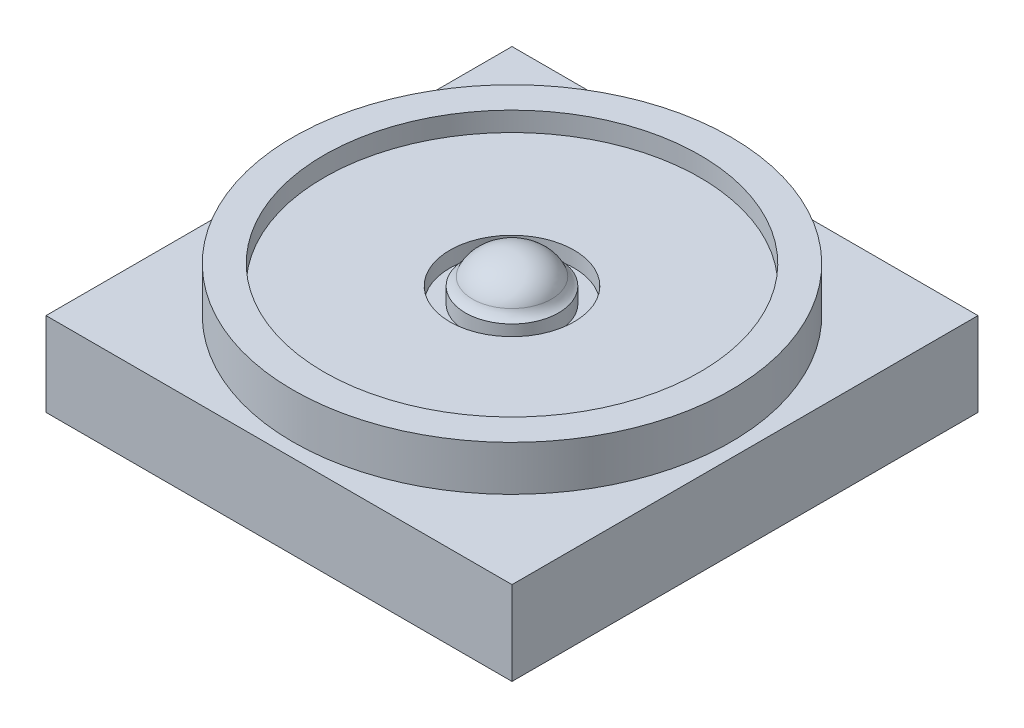
from build123d import *

# Parameters (mm, degrees)
SKETCH3_W             = 30
SKETCH3_H             = 30
SKETCH3_R             = 14.1
RECTANGLE_DEPTH       = 5.4
SKETCH3_3_R           = 14.1
SKETCH3_3_R_2         = 12.1
RIM_DEPTH             = 8.3
SKETCH3_5_R           = 12.1
SKETCH3_5_R_2         = 4
FLAT_FACE_DEPTH       = 7.05
SKETCH3_6_R           = 4
SKETCH3_6_R_2         = 3
GAP_DEPTH             = 6.05
SKETCH3_7_R           = 3
DOME_FACE_OUTER_DEPTH = 7.05
SKETCH5_R             = 2.64
DOME_FACE_INNER_DEPTH = 0.001
DOME_FACE_RADIUS      = 2.64
DOME_HEIGHT           = 1.95
DOME_FILLET_R         = 1.05
SKETCH6_W             = 2.512820513
SKETCH6_H             = 0.224358975
LABEL_DEPTH           = 0.2


with BuildPart() as part:
    # Sketch3 → Rectangle (new body)
    with BuildSketch(Plane(origin=(0, 0, 0), x_dir=(1, 0, 0), z_dir=(0, 1, 0))):
        Rectangle(SKETCH3_W, SKETCH3_H)
        with Locations(Location((0, 0, 0), (0, 0, 90))):
            Circle(SKETCH3_R, mode=Mode.SUBTRACT)
    extrude(amount=RECTANGLE_DEPTH)

    # Sketch3<3> → Rim (add)
    with BuildSketch(Plane(origin=(0, 0, 0), x_dir=(1, 0, 0), z_dir=(0, 1, 0))):
        with Locations(Location((0, 0, 0), (0, 0, 270))):
            Circle(SKETCH3_3_R)
        with Locations(Location((0, 0, 0), (0, 0, 270))):
            Circle(SKETCH3_3_R_2, mode=Mode.SUBTRACT)
    extrude(amount=RIM_DEPTH)

    # Sketch3<5> → Flat_face (add)
    with BuildSketch(Plane(origin=(0, 0, 0), x_dir=(1, 0, 0), z_dir=(0, 1, 0))):
        with Locations(Location((0, 0, 0), (0, 0, 270))):
            Circle(SKETCH3_5_R)
        with Locations(Location((0, 0, 0), (0, 0, 270))):
            Circle(SKETCH3_5_R_2, mode=Mode.SUBTRACT)
    extrude(amount=FLAT_FACE_DEPTH)

    # Sketch3<6> → Gap (add)
    with BuildSketch(Plane(origin=(0, 0, 0), x_dir=(1, 0, 0), z_dir=(0, 1, 0))):
        with Locations(Location((0, 0, 0), (0, 0, 270))):
            Circle(SKETCH3_6_R)
        with Locations(Location((0, 0, 0), (0, 0, 270))):
            Circle(SKETCH3_6_R_2, mode=Mode.SUBTRACT)
    extrude(amount=GAP_DEPTH)

    # Sketch3<7> → Dome_face_outer (add)
    with BuildSketch(Plane(origin=(0, 0, 0), x_dir=(1, 0, 0), z_dir=(0, 1, 0))):
        with Locations(Location((0, 0, 0), (0, 0, 270))):
            Circle(SKETCH3_7_R)
    extrude(amount=DOME_FACE_OUTER_DEPTH)

    # Sketch5 → Dome_face_inner (add)
    with BuildSketch(Plane(origin=(0, 7.05, 0), x_dir=(1, 0, 0), z_dir=(0, 1, 0))):
        with Locations(Location((0, 0, 0), (0, 0, 270))):
            Circle(SKETCH5_R)
    extrude(amount=DOME_FACE_INNER_DEPTH)

    # Dome: an elliptical dome of height H over a round flat face of radius A is half a spheroid: the quarter ellipse of half axes A and H revolved about the face's axis
    with BuildSketch(Plane((0, 7.051, 0), x_dir=(0, 0, -1), z_dir=(1, 0, 0)), mode=Mode.PRIVATE) as dome_quarter:
        Ellipse(DOME_FACE_RADIUS, DOME_HEIGHT)
        Rectangle(DOME_FACE_RADIUS, DOME_HEIGHT, align=(Align.MIN, Align.MIN), mode=Mode.INTERSECT)
    revolve(dome_quarter.sketch, axis=Axis((0, 7.051, 0), (0, 1, 0)))

    # Dome_Fillet
    # the kernel refuses this fillet: 1.05 mm, written as the material it adds along each edge
    with BuildSketch(Plane(origin=(0, 7.05, 0), x_dir=(0, 0, 1), z_dir=(-1, 0, 0))) as dome_fillet_piece_1:
        with BuildLine():
            CenterArc((3.518709078, 0.91292984), DOME_FILLET_R, 201.086857752, 39.308741684)
            Line((2.539021189, 0.535157898), (2.441052401, 0.497380703))
            ThreePointArc((2.441052401, 0.497380703), (2.535, 0.001), (2.535, 0))
            Line((2.535, 0), (2.64, -0.105))
            ThreePointArc((2.64, -0.105), (2.82, -0.105), (2.948129092, -0.091292984))
            Line((2.948129092, -0.091292984), (3, 0))
        make_face()
    revolve(axis=Axis((0, 7.05, 0), (0, 1, 0)))

    # Sketch6 → Label (cut)
    # profile 1 of 8: a face of its own
    with BuildSketch(Plane(origin=(0, 0, 0), x_dir=(1, 0, 0), z_dir=(0, 1, 0))):
        Polygon((6.943950172, -6.089985338), (5.328565557, -9.589985338), (5.670011871, -9.589985338), (6.187439755, -8.468190467), (7.774078377, -8.468190467), (8.306229819, -9.589985338), (8.649078377, -9.589985338), (6.988821967, -6.089985338), align=None)
        Polygon((6.969891678, -6.772176845), (7.603705781, -8.109216108), (6.352904499, -8.109216108), align=None, mode=Mode.SUBTRACT)
    # profile 2 of 8: a face of its own
    with BuildSketch(Plane(origin=(0, 0, 0), x_dir=(1, 0, 0), z_dir=(0, 1, 0))):
        Polygon((4.700360428, -6.089985338), (4.386257864, -6.089985338), (4.386257864, -9.231010979), (3.040104018, -9.231010979), (3.040104018, -9.589985338), (4.700360428, -9.589985338), align=None)
    # profile 3 of 8: a face of its own
    with BuildSketch(Plane(origin=(0, 0, 0), x_dir=(1, 0, 0), z_dir=(0, 1, 0))):
        Polygon((2.456770685, -6.089985338), (2.142668121, -6.089985338), (2.142668121, -9.231010979), (0.796514274, -9.231010979), (0.796514274, -9.589985338), (2.456770685, -9.589985338), align=None)
    # profile 4 of 8: a face of its own
    with BuildSketch(Plane(origin=(0, 0, 0), x_dir=(1, 0, 0), z_dir=(0, 1, 0))):
        with Locations((-0.549639571, -10.061139184)):
            Rectangle(SKETCH6_W, SKETCH6_H)
    # profile 5 of 8: a face of its own
    with BuildSketch(Plane(origin=(0, 0, 0), x_dir=(1, 0, 0), z_dir=(0, 1, 0))):
        with BuildLine():
            add(Edge.make_bspline(
                [(-3.847716495, -6.000241749), (-3.912524601, -6.001883228), (-4.039813068, -6.005107229), (-4.226887965, -6.029786332), (-4.405483061, -6.072481722), (-4.577053199, -6.129344705), (-4.739546176, -6.20519909), (-4.894185069, -6.296884239), (-5.040601942, -6.405360697), (-5.176823324, -6.529789924), (-5.301480274, -6.665173378), (-5.41130616, -6.809651288), (-5.503348454, -6.962350091), (-5.578934241, -7.122810921), (-5.638232851, -7.290670889), (-5.679151895, -7.466824892), (-5.705290045, -7.650131582), (-5.708345822, -7.775158447), (-5.709895982, -7.838583095)],
                knots=[0, 0, 0, 0, 1.065120563, 2.091984664, 3.0946048, 4.079830382, 5.057816894, 6.036188127, 7.030412546, 8.04752943, 9.064399622, 10.05169764, 11.02544977, 11.989514704, 12.962713494, 13.945757189, 14.957906945, 16, 16, 16, 16], degree=3))
            add(Edge.make_bspline(
                [(-5.709895982, -7.838583095), (-5.708346049, -7.901540541), (-5.705290953, -8.025636962), (-5.679122175, -8.207780406), (-5.638081175, -8.382871102), (-5.579484909, -8.550616755), (-5.504259431, -8.711194319), (-5.41160426, -8.864181273), (-5.302463049, -9.009627771), (-5.178256198, -9.145940436), (-5.042855156, -9.270937907), (-4.897624889, -9.379856783), (-4.745831569, -9.473580907), (-4.585521861, -9.548364581), (-4.418821824, -9.608136502), (-4.244239501, -9.648889132), (-4.062592947, -9.675176175), (-3.938721943, -9.678194691), (-3.875761367, -9.679728928)],
                knots=[0, 0, 0, 0, 1.043624062, 2.057103931, 3.04512605, 4.022047818, 4.998200453, 5.980619268, 6.982898556, 8.009068085, 9.034988726, 10.034168286, 11.015286542, 11.987931943, 12.962482838, 13.94673481, 14.956375938, 16, 16, 16, 16], degree=3))
            add(Edge.make_bspline(
                [(-3.875761367, -9.679728928), (-3.812337048, -9.678179541), (-3.687310832, -9.675125287), (-3.503773796, -9.648943883), (-3.327496052, -9.608002579), (-3.158981701, -9.549493143), (-2.998136772, -9.473875912), (-2.844646689, -9.381671533), (-2.699127542, -9.272264392), (-2.562785795, -9.148097817), (-2.438036597, -9.012926265), (-2.329277221, -8.86809201), (-2.237052108, -8.716436553), (-2.161688775, -8.557539029), (-2.102024316, -8.392167586), (-2.061319498, -8.219219109), (-2.034983546, -8.039679603), (-2.031948699, -7.917436705), (-2.030408802, -7.855410018)],
                knots=[0, 0, 0, 0, 1.053102029, 2.075944431, 3.073151272, 4.055350789, 5.033113405, 6.020478099, 7.024410459, 8.052272461, 9.079885166, 10.07527673, 11.055994387, 12.023226415, 12.992069828, 13.970394897, 14.97016774, 16, 16, 16, 16], degree=3))
            add(Edge.make_bspline(
                [(-2.030408802, -7.855410018), (-2.030943438, -7.813777349), (-2.032005964, -7.731037225), (-2.044797657, -7.608170625), (-2.063359358, -7.487279967), (-2.089961271, -7.368709019), (-2.124752938, -7.252748035), (-2.165804965, -7.138597272), (-2.21594481, -7.027413548), (-2.272625458, -6.918670156), (-2.335887266, -6.81406225), (-2.405763016, -6.715182667), (-2.479798384, -6.621201671), (-2.560961778, -6.534554667), (-2.646578223, -6.45272101), (-2.738036601, -6.376958293), (-2.834778846, -6.306583342), (-2.937221225, -6.243163001), (-3.0428395, -6.185803867), (-3.151716278, -6.136582016), (-3.26237285, -6.094335954), (-3.375327497, -6.060095129), (-3.49028027, -6.033063093), (-3.607482054, -6.014655739), (-3.72683948, -6.001831421), (-3.807250799, -6.000773919), (-3.847716495, -6.000241749)],
                knots=[0, 0, 0, 0, 1.037015668, 2.060948919, 3.074880161, 4.083647147, 5.086022904, 6.090072063, 7.104153813, 8.122640571, 9.144368836, 10.147691507, 11.138137339, 12.123020368, 13.103399296, 14.087645067, 15.080126199, 16.082011238, 17.087798457, 18.072939717, 19.057185487, 20.037253025, 21.01195951, 21.997135196, 22.992090687, 24, 24, 24, 24], degree=3))
        make_face()
        with BuildLine():
            add(Edge.make_bspline(
                [(-3.863141174, -6.359216108), (-3.829926541, -6.359620998), (-3.763814808, -6.360426908), (-3.665530272, -6.371042623), (-3.568538338, -6.386172512), (-3.472818976, -6.407754033), (-3.378772686, -6.437158086), (-3.285522845, -6.470998994), (-3.193919791, -6.512220084), (-3.104265933, -6.558792789), (-3.017350858, -6.61034171), (-2.935338157, -6.667313477), (-2.858015513, -6.728372031), (-2.785572246, -6.793659868), (-2.718221074, -6.86350947), (-2.654636372, -6.936861906), (-2.597366791, -7.015813797), (-2.544881214, -7.098224204), (-2.497913374, -7.183985785), (-2.456148019, -7.272195648), (-2.42198401, -7.363573334), (-2.394121634, -7.457127492), (-2.371021823, -7.552709952), (-2.356387899, -7.6510458), (-2.345655539, -7.751640912), (-2.344895694, -7.819622767), (-2.344511367, -7.854007774)],
                knots=[0, 0, 0, 0, 1.008559885, 2.007477868, 2.99961109, 3.989939068, 4.984837346, 5.991145699, 7.001802488, 8.033829008, 9.059044045, 10.069351652, 11.065060232, 12.050310815, 13.029377138, 14.011219647, 14.996725999, 15.989392538, 16.977580475, 17.965360261, 18.951710183, 19.937753436, 20.929683414, 21.935841486, 22.955955122, 24, 24, 24, 24], degree=3))
            add(Edge.make_bspline(
                [(-2.344511367, -7.854007774), (-2.345786229, -7.904569995), (-2.348294276, -8.004041525), (-2.370251846, -8.149809669), (-2.404073821, -8.289897956), (-2.453931187, -8.423539865), (-2.516281802, -8.551884148), (-2.593308692, -8.673792252), (-2.684567778, -8.789297127), (-2.788231304, -8.897592396), (-2.901554011, -8.9964382), (-3.021886741, -9.083201609), (-3.147940349, -9.156611858), (-3.280043551, -9.216416931), (-3.41749109, -9.263806669), (-3.561168641, -9.2962853), (-3.710119101, -9.317660755), (-3.811649756, -9.319713511), (-3.863141174, -9.320754569)],
                knots=[0, 0, 0, 0, 1.032063989, 2.030389145, 3.003944642, 3.970395727, 4.937377036, 5.913328081, 6.909231446, 7.93887556, 8.970685674, 9.976071282, 10.964166581, 11.944589148, 12.933237628, 13.927779006, 14.949070134, 16, 16, 16, 16], degree=3))
            add(Edge.make_bspline(
                [(-3.863141174, -9.320754569), (-3.897750676, -9.320279065), (-3.966391712, -9.319335997), (-4.068487235, -9.30983732), (-4.168743446, -9.294605451), (-4.267019726, -9.272674795), (-4.363204538, -9.245227589), (-4.457699341, -9.212619861), (-4.549497631, -9.171938657), (-4.639757469, -9.126990705), (-4.726153711, -9.075750548), (-4.808629243, -9.020712398), (-4.885105223, -8.959743777), (-4.957494294, -8.895425965), (-5.025121983, -8.826462117), (-5.087530967, -8.752941895), (-5.144511099, -8.674401238), (-5.196976746, -8.592115832), (-5.243780009, -8.506119579), (-5.284559108, -8.417589902), (-5.319155224, -8.326744792), (-5.347083729, -8.233453221), (-5.36896919, -8.137892372), (-5.38404911, -8.039934294), (-5.394597549, -7.939774951), (-5.395392626, -7.872031095), (-5.395793418, -7.837881973)],
                knots=[0, 0, 0, 0, 1.047197238, 2.076906641, 3.100256066, 4.114471768, 5.12198147, 6.126382909, 7.136867548, 8.15857795, 9.17633901, 10.174870724, 11.156907918, 12.133735059, 13.104061851, 14.077631395, 15.04955518, 16.038496417, 17.029181396, 18.010275684, 18.986308667, 19.968651475, 20.955262928, 21.950658345, 22.966943676, 24, 24, 24, 24], degree=3))
            add(Edge.make_bspline(
                [(-5.395793418, -7.837881973), (-5.395392305, -7.803966469), (-5.394596623, -7.736688819), (-5.384054149, -7.637228), (-5.368953258, -7.539974789), (-5.34719055, -7.445310986), (-5.319140397, -7.353212461), (-5.284553066, -7.263765713), (-5.243767767, -7.176637518), (-5.196959542, -7.092043221), (-5.144343719, -7.010868483), (-5.086849476, -6.93326607), (-5.023484127, -6.860693329), (-4.956058103, -6.791358635), (-4.882887217, -6.726740745), (-4.804302923, -6.666818225), (-4.721259245, -6.61014495), (-4.63333201, -6.559019389), (-4.542588056, -6.511805156), (-4.449474098, -6.471354153), (-4.355044999, -6.436982033), (-4.259540886, -6.407665068), (-4.162157908, -6.386257038), (-4.063554079, -6.371028988), (-3.963865821, -6.360430602), (-3.896822601, -6.359622224), (-3.863141174, -6.359216108)],
                knots=[0, 0, 0, 0, 1.02996197, 2.043119294, 3.035359645, 4.018872909, 4.991431989, 5.957985074, 6.929999688, 7.912076566, 8.892894881, 9.867085534, 10.843653904, 11.817741046, 12.803660682, 13.806313499, 14.818574707, 15.856120519, 16.894564902, 17.924820532, 18.937903209, 19.946497019, 20.957711757, 21.963978472, 22.977135795, 24, 24, 24, 24], degree=3))
        make_face(mode=Mode.SUBTRACT)
    # profile 6 of 8: a face of its own
    with BuildSketch(Plane(origin=(0, 0, 0), x_dir=(1, 0, 0), z_dir=(0, 1, 0))):
        with BuildLine():
            Line((-6.068870341, -8.91480505), (-6.364743738, -8.737421236))
            add(Edge.make_bspline(
                [(-6.364743738, -8.737421236), (-6.392261976, -8.783485621), (-6.444985856, -8.871743205), (-6.532937215, -8.991001245), (-6.624070127, -9.092363402), (-6.71905946, -9.175240009), (-6.817325408, -9.240488896), (-6.919509462, -9.286691128), (-7.025267273, -9.315507103), (-7.097241094, -9.31900719), (-7.133173226, -9.320754569)],
                knots=[0, 0, 0, 0, 1.272034388, 2.437168799, 3.508375237, 4.49857839, 5.41946034, 6.295179144, 7.148887113, 8, 8, 8, 8], degree=3))
            add(Edge.make_bspline(
                [(-7.133173226, -9.320754569), (-7.163860086, -9.319899897), (-7.224696859, -9.318205506), (-7.314259102, -9.301924704), (-7.401240904, -9.276912575), (-7.483849542, -9.241091644), (-7.560945157, -9.197753158), (-7.628551852, -9.145406981), (-7.686997965, -9.086800775), (-7.73480708, -9.02141812), (-7.771487115, -8.951100972), (-7.799679183, -8.87892502), (-7.815324257, -8.803756452), (-7.81768101, -8.753145989), (-7.818870341, -8.727605531)],
                knots=[0, 0, 0, 0, 1.095163259, 2.171163733, 3.241058638, 4.321873601, 5.38011039, 6.391990106, 7.366004449, 8.327778327, 9.272591725, 10.192022065, 11.087607919, 12, 12, 12, 12], degree=3))
            add(Edge.make_bspline(
                [(-7.818870341, -8.727605531), (-7.81739603, -8.698464681), (-7.814398972, -8.639225592), (-7.789067492, -8.551825939), (-7.749218245, -8.465333369), (-7.712455601, -8.411832103), (-7.69336954, -8.384055851)],
                knots=[0, 0, 0, 0, 0.938893495, 1.908633276, 2.914225137, 4, 4, 4, 4], degree=3))
            add(Edge.make_bspline(
                [(-7.69336954, -8.384055851), (-7.677698925, -8.364009028), (-7.644800431, -8.321923229), (-7.588242919, -8.259277994), (-7.521876804, -8.194659575), (-7.447973249, -8.125600518), (-7.363840161, -8.055312721), (-7.272112646, -7.980444443), (-7.170448787, -7.903842866), (-7.099149291, -7.8524703), (-7.062359924, -7.825962902)],
                knots=[0, 0, 0, 0, 0.722233717, 1.516239348, 2.393582979, 3.351407094, 4.387010283, 5.505090956, 6.712668013, 8, 8, 8, 8], degree=3))
            add(Edge.make_bspline(
                [(-7.062359924, -7.825962902), (-7.025535928, -7.799734315), (-6.955131251, -7.749587253), (-6.856672669, -7.675162969), (-6.768628206, -7.607119099), (-6.69138919, -7.544815087), (-6.624989593, -7.488242482), (-6.568906182, -7.437944543), (-6.524567625, -7.392560982), (-6.499912044, -7.36311964), (-6.488842296, -7.349901204)],
                knots=[0, 0, 0, 0, 1.452282411, 2.77665338, 3.964542531, 5.026858415, 5.96415736, 6.766646006, 7.446254459, 8, 8, 8, 8], degree=3))
            add(Edge.make_bspline(
                [(-6.488842296, -7.349901204), (-6.473369751, -7.329300167), (-6.442940914, -7.288785463), (-6.402774909, -7.225460605), (-6.368635746, -7.16063734), (-6.341873414, -7.094141475), (-6.319337195, -7.026906547), (-6.304179264, -6.958055301), (-6.294687867, -6.887896682), (-6.293715881, -6.840683182), (-6.293229315, -6.81704864)],
                knots=[0, 0, 0, 0, 1.068054152, 2.10047183, 3.106115577, 4.101338837, 5.06977816, 6.043150881, 7.020423561, 8, 8, 8, 8], degree=3))
            add(Edge.make_bspline(
                [(-6.293229315, -6.81704864), (-6.294534524, -6.780018865), (-6.297117044, -6.706750801), (-6.318957562, -6.599719971), (-6.353430455, -6.497533554), (-6.401725343, -6.40120322), (-6.463982696, -6.313237239), (-6.53602867, -6.232623752), (-6.621840157, -6.16485517), (-6.71599278, -6.105643111), (-6.819049152, -6.059297186), (-6.927040055, -6.024336206), (-7.040137127, -6.004526948), (-7.116740262, -6.001684184), (-7.155609123, -6.000241749)],
                knots=[0, 0, 0, 0, 1.005424448, 1.989358655, 2.955360095, 3.929531133, 4.905563448, 5.876582895, 6.856512386, 7.866279853, 8.892233794, 9.918561126, 10.94386622, 12, 12, 12, 12], degree=3))
            add(Edge.make_bspline(
                [(-7.155609123, -6.000241749), (-7.196853223, -6.0016643), (-7.278874575, -6.004493301), (-7.399523791, -6.029090833), (-7.515684507, -6.069791504), (-7.609127772, -6.115980162), (-7.682260533, -6.162111578), (-7.738033266, -6.204131402), (-7.794550717, -6.252506511), (-7.852268772, -6.307365757), (-7.910209431, -6.369212508), (-7.969232883, -6.437623197), (-8.029477152, -6.512179753), (-8.068233012, -6.565404254), (-8.08810111, -6.592689665)],
                knots=[0, 0, 0, 0, 1.286793592, 2.559021753, 3.825965368, 5.121522368, 5.803751409, 6.523245864, 7.299691795, 8.125521123, 9.008227632, 9.944561021, 10.946284179, 12, 12, 12, 12], degree=3))
            Line((-8.08810111, -6.592689665), (-7.804146783, -6.807934056))
            add(Edge.make_bspline(
                [(-7.804146783, -6.807934056), (-7.787000851, -6.785845366), (-7.753981794, -6.743307713), (-7.703852307, -6.683736397), (-7.656603659, -6.629319918), (-7.610053259, -6.58205479), (-7.566659628, -6.539352656), (-7.524542585, -6.502792899), (-7.484308234, -6.472017304), (-7.433591324, -6.439173744), (-7.369873605, -6.40661724), (-7.289889069, -6.379068162), (-7.206302794, -6.3625131), (-7.149373162, -6.360324213), (-7.120553033, -6.359216108)],
                knots=[0, 0, 0, 0, 1.181633172, 2.275549214, 3.290209073, 4.226197932, 5.078386478, 5.862611352, 6.581680152, 7.217281963, 8.414376989, 9.595101626, 10.782541182, 12, 12, 12, 12], degree=3))
            add(Edge.make_bspline(
                [(-7.120553033, -6.359216108), (-7.084396511, -6.360427808), (-7.014672063, -6.362764457), (-6.915681827, -6.388284442), (-6.826587902, -6.428466302), (-6.750035337, -6.48478128), (-6.68629836, -6.551502273), (-6.640192901, -6.628281128), (-6.612442737, -6.713063531), (-6.609056457, -6.772205187), (-6.607331879, -6.802325082)],
                knots=[0, 0, 0, 0, 1.14458467, 2.207223713, 3.21896685, 4.227309161, 5.202851033, 6.127160689, 7.046193047, 8, 8, 8, 8], degree=3))
            add(Edge.make_bspline(
                [(-6.607331879, -6.802325082), (-6.607725006, -6.82107656), (-6.608511902, -6.85861018), (-6.6194867, -6.914061602), (-6.633586029, -6.969372941), (-6.655928661, -7.024295524), (-6.686773964, -7.079789883), (-6.72727914, -7.136811621), (-6.778292452, -7.195863329), (-6.817369464, -7.234270703), (-6.83800095, -7.25454864)],
                knots=[0, 0, 0, 0, 0.858281714, 1.717966888, 2.583508476, 3.4729293, 4.427298488, 5.488583878, 6.674047936, 8, 8, 8, 8], degree=3))
            add(Edge.make_bspline(
                [(-6.83800095, -7.25454864), (-6.845662322, -7.261385665), (-6.863863989, -7.277628874), (-6.897139915, -7.304221154), (-6.941082713, -7.337023927), (-6.994544915, -7.377611243), (-7.058512276, -7.424692705), (-7.132991832, -7.477666317), (-7.217153365, -7.538251776), (-7.276875281, -7.580609317), (-7.308453674, -7.603006172)],
                knots=[0, 0, 0, 0, 0.420754252, 0.999615792, 1.744751191, 2.668019286, 3.750313428, 4.999500688, 6.413464383, 8, 8, 8, 8], degree=3))
            add(Edge.make_bspline(
                [(-7.308453674, -7.603006172), (-7.346439588, -7.630647531), (-7.419994044, -7.684171193), (-7.524651624, -7.764586873), (-7.619545432, -7.843234642), (-7.705008636, -7.919612249), (-7.781885544, -7.993140342), (-7.849323265, -8.064703522), (-7.908008945, -8.133789095), (-7.971188163, -8.22236167), (-8.035745983, -8.331142755), (-8.09118749, -8.464420993), (-8.126145838, -8.598217314), (-8.130717353, -8.68814415), (-8.132972905, -8.732513383)],
                knots=[0, 0, 0, 0, 1.163667725, 2.253281268, 3.268753668, 4.215851969, 5.092017293, 5.902905408, 6.650798638, 7.335211899, 8.59617414, 9.77448103, 10.901945474, 12, 12, 12, 12], degree=3))
            add(Edge.make_bspline(
                [(-8.132972905, -8.732513383), (-8.132315767, -8.763891748), (-8.131014252, -8.826039132), (-8.116053338, -8.917294209), (-8.094133673, -9.005925078), (-8.061096439, -9.090836191), (-8.020773281, -9.173580954), (-7.969607033, -9.251988854), (-7.910299348, -9.327795253), (-7.842265583, -9.398978744), (-7.767819681, -9.46432494), (-7.689135986, -9.522454001), (-7.606085713, -9.570922325), (-7.519119397, -9.610473167), (-7.42821706, -9.641406684), (-7.333409276, -9.663819553), (-7.234539765, -9.677575264), (-7.167339283, -9.679003026), (-7.133173226, -9.679728928)],
                knots=[0, 0, 0, 0, 0.983748083, 1.948392443, 2.894712957, 3.844097841, 4.80183111, 5.778335162, 6.776009319, 7.81870978, 8.863265674, 9.881300176, 10.883814829, 11.87499822, 12.874611388, 13.892143829, 14.928324115, 16, 16, 16, 16], degree=3))
            add(Edge.make_bspline(
                [(-7.133173226, -9.679728928), (-7.106737883, -9.679217747), (-7.054200123, -9.678201821), (-6.976490641, -9.669220541), (-6.900351051, -9.656513437), (-6.826736769, -9.636339367), (-6.754699358, -9.61186239), (-6.684552123, -9.581724057), (-6.616261069, -9.545606856), (-6.549443487, -9.504311831), (-6.484269312, -9.456254087), (-6.421349844, -9.40028059), (-6.358620658, -9.337935085), (-6.297933262, -9.267524522), (-6.238060118, -9.190186439), (-6.180181708, -9.105197256), (-6.123099991, -9.013019902), (-6.087284523, -8.948154816), (-6.068870341, -8.91480505)],
                knots=[0, 0, 0, 0, 0.915332311, 1.819136955, 2.706846663, 3.586547465, 4.459518054, 5.340707479, 6.227863349, 7.133153174, 8.059268498, 9.028702269, 10.047606654, 11.120612155, 12.245963614, 13.433783089, 14.680604001, 16, 16, 16, 16], degree=3))
        make_face()
    # profile 7 of 8: a face of its own
    with BuildSketch(Plane(origin=(0, 0, 0), x_dir=(1, 0, 0), z_dir=(0, 1, 0))):
        with Locations((-9.613742136, -10.061139184)):
            Rectangle(SKETCH6_W, SKETCH6_H)
    # profile 8 of 8: a face of its own
    with BuildSketch(Plane(origin=(0, 0, 0), x_dir=(1, 0, 0), z_dir=(0, 1, 0))):
        with BuildLine():
            Line((-11.184254956, -7.032293031), (-11.49835752, -7.032293031))
            Line((-11.49835752, -7.032293031), (-11.49835752, -7.476804249))
            add(Edge.make_bspline(
                [(-11.49835752, -7.476804249), (-11.52664147, -7.437916647), (-11.58083623, -7.363404274), (-11.669701882, -7.26521399), (-11.758477995, -7.181885835), (-11.822411377, -7.138142963), (-11.853125149, -7.117128768)],
                knots=[0, 0, 0, 0, 1.134379233, 2.173579362, 3.122582517, 4, 4, 4, 4], degree=3))
            add(Edge.make_bspline(
                [(-11.853125149, -7.117128768), (-11.894989811, -7.097123403), (-11.977987711, -7.057462189), (-12.109406935, -7.01722863), (-12.243881605, -6.992503529), (-12.334689819, -6.989122156), (-12.380368738, -6.987421236)],
                knots=[0, 0, 0, 0, 1.014936303, 2.012140481, 3.000054389, 4, 4, 4, 4], degree=3))
            add(Edge.make_bspline(
                [(-12.380368738, -6.987421236), (-12.411261735, -6.988466527), (-12.472397314, -6.990535101), (-12.562981404, -7.003995136), (-12.650840016, -7.027261309), (-12.735454045, -7.059668633), (-12.815174725, -7.09891532), (-12.888263922, -7.144965028), (-12.95388813, -7.196662103), (-13.012014182, -7.256341036), (-13.064283207, -7.325677635), (-13.112362054, -7.406541884), (-13.156787266, -7.500749545), (-13.181408575, -7.569116086), (-13.194371142, -7.605109537)],
                knots=[0, 0, 0, 0, 1.009824226, 1.998387844, 2.986035974, 3.974953746, 4.955485308, 5.885931332, 6.793869504, 7.679848016, 8.601185859, 9.625726857, 10.749998409, 12, 12, 12, 12], degree=3))
            add(Edge.make_bspline(
                [(-13.194371142, -7.605109537), (-13.208082394, -7.580385118), (-13.235064211, -7.531730933), (-13.280369848, -7.462872671), (-13.327837644, -7.398465879), (-13.377872137, -7.338459454), (-13.430296724, -7.283149724), (-13.485358124, -7.232353822), (-13.542742906, -7.185853609), (-13.622535146, -7.131530449), (-13.726347753, -7.073829268), (-13.857235868, -7.023800824), (-13.993386039, -6.992884695), (-14.085803738, -6.989254423), (-14.132472104, -6.987421236)],
                knots=[0, 0, 0, 0, 0.86119277, 1.694706429, 2.50939023, 3.298075842, 4.073795165, 4.829715201, 5.57930267, 6.321991688, 7.768977793, 9.186738141, 10.579381044, 12, 12, 12, 12], degree=3))
            add(Edge.make_bspline(
                [(-14.132472104, -6.987421236), (-14.175353567, -6.989038457), (-14.259276753, -6.992203515), (-14.381454019, -7.017056988), (-14.495395824, -7.059734635), (-14.6008729, -7.117968272), (-14.696032713, -7.191147455), (-14.778749023, -7.278216293), (-14.848519386, -7.378558916), (-14.894098026, -7.472950905), (-14.92501329, -7.556286237), (-14.944074524, -7.627292529), (-14.960914219, -7.705444082), (-14.974895465, -7.790834343), (-14.985114017, -7.883764951), (-14.992684732, -7.984083827), (-14.997808806, -8.091868939), (-14.998170878, -8.166234439), (-14.99835752, -8.204568672)],
                knots=[0, 0, 0, 0, 1.209669288, 2.367440248, 3.500751976, 4.631527125, 5.755587489, 6.87532382, 8.007944318, 9.190864318, 9.82315674, 10.514484317, 11.263564316, 12.079023757, 12.955305781, 13.901327259, 14.918167583, 16, 16, 16, 16], degree=3))
            Line((-14.99835752, -8.204568672), (-14.99835752, -9.589985338))
            Line((-14.99835752, -9.589985338), (-14.684254956, -9.589985338))
            Line((-14.684254956, -9.589985338), (-14.684254956, -8.203166428))
            add(Edge.make_bspline(
                [(-14.684254956, -8.203166428), (-14.684177073, -8.170445854), (-14.684027394, -8.107561887), (-14.681333763, -8.017309436), (-14.676258448, -7.935041079), (-14.67032381, -7.860868991), (-14.66208, -7.794620202), (-14.651434069, -7.736427784), (-14.640156389, -7.685833972), (-14.621420398, -7.629747925), (-14.591472506, -7.567877714), (-14.545855026, -7.501154138), (-14.48838492, -7.443073338), (-14.422024763, -7.392655021), (-14.346476318, -7.35166138), (-14.263211595, -7.322385371), (-14.172747544, -7.304262492), (-14.110124755, -7.302456477), (-14.077784604, -7.3015238)],
                knots=[0, 0, 0, 0, 1.253487763, 2.409012846, 3.458416907, 4.410876679, 5.259312806, 6.014470957, 6.676830364, 7.243083969, 8.276244668, 9.299465089, 10.325150304, 11.392391894, 12.482080715, 13.603491619, 14.762376348, 16, 16, 16, 16], degree=3))
            add(Edge.make_bspline(
                [(-14.077784604, -7.3015238), (-14.038114649, -7.302939957), (-13.959711738, -7.305738823), (-13.845266252, -7.334312696), (-13.735295235, -7.377392946), (-13.633080102, -7.439825403), (-13.539052312, -7.514633767), (-13.458152734, -7.603583363), (-13.391320548, -7.70421329), (-13.346066572, -7.797359992), (-13.317477271, -7.881029436), (-13.298600355, -7.954126808), (-13.283916964, -8.037208376), (-13.270146435, -8.129715867), (-13.261158707, -8.232286047), (-13.252990334, -8.344444448), (-13.249169472, -8.466528408), (-13.248635013, -8.551155096), (-13.24835752, -8.595093511)],
                knots=[0, 0, 0, 0, 1.090531906, 2.155305635, 3.229839962, 4.33261226, 5.44038871, 6.529323825, 7.629011124, 8.757537029, 9.370236727, 10.061839251, 10.834451254, 11.692844982, 12.636905849, 13.66920014, 14.789842145, 16, 16, 16, 16], degree=3))
            Line((-13.24835752, -8.595093511), (-13.24835752, -9.589985338))
            Line((-13.24835752, -9.589985338), (-12.934254956, -9.589985338))
            Line((-12.934254956, -9.589985338), (-12.934254956, -8.289404409))
            add(Edge.make_bspline(
                [(-12.934254956, -8.289404409), (-12.934175525, -8.25271109), (-12.934022708, -8.182116833), (-12.931346391, -8.080883158), (-12.926259769, -7.988802078), (-12.920379221, -7.905980614), (-12.911919042, -7.832569285), (-12.90230928, -7.768174527), (-12.89096067, -7.712957776), (-12.872170785, -7.652394391), (-12.843456317, -7.585673468), (-12.797268055, -7.514532447), (-12.739660474, -7.452264349), (-12.672089598, -7.399105601), (-12.596083916, -7.35516412), (-12.512100515, -7.323504368), (-12.420895603, -7.305080078), (-12.358017897, -7.302731581), (-12.325681238, -7.3015238)],
                knots=[0, 0, 0, 0, 1.320475261, 2.540461679, 3.643808994, 4.639130445, 5.527981419, 6.302341397, 6.981980563, 7.553956391, 8.582137848, 9.585246428, 10.591171744, 11.620968678, 12.668337649, 13.738356861, 14.836885341, 16, 16, 16, 16], degree=3))
            add(Edge.make_bspline(
                [(-12.325681238, -7.3015238), (-12.287665027, -7.30305426), (-12.211900067, -7.306104412), (-12.100598098, -7.333558686), (-11.993112414, -7.376562761), (-11.891157715, -7.43622258), (-11.797483567, -7.510121659), (-11.7154753, -7.597036554), (-11.646532774, -7.695885588), (-11.600800959, -7.788050104), (-11.571302485, -7.869623379), (-11.551707151, -7.938974327), (-11.534867525, -8.015974575), (-11.522353503, -8.100861686), (-11.510273087, -8.193082781), (-11.504442778, -8.29309727), (-11.498771216, -8.400819358), (-11.498498802, -8.475191903), (-11.49835752, -8.513763383)],
                knots=[0, 0, 0, 0, 1.098833095, 2.189935336, 3.297829714, 4.440610912, 5.596351641, 6.740013378, 7.886572111, 9.072425424, 9.705826452, 10.395263256, 11.156850408, 11.985370555, 12.878090359, 13.847760091, 14.883794034, 16, 16, 16, 16], degree=3))
            Line((-11.49835752, -8.513763383), (-11.49835752, -9.589985338))
            Line((-11.49835752, -9.589985338), (-11.184254956, -9.589985338))
            Line((-11.184254956, -9.589985338), (-11.184254956, -7.032293031))
        make_face()
    extrude(amount=LABEL_DEPTH, mode=Mode.SUBTRACT)


solid = part.part
